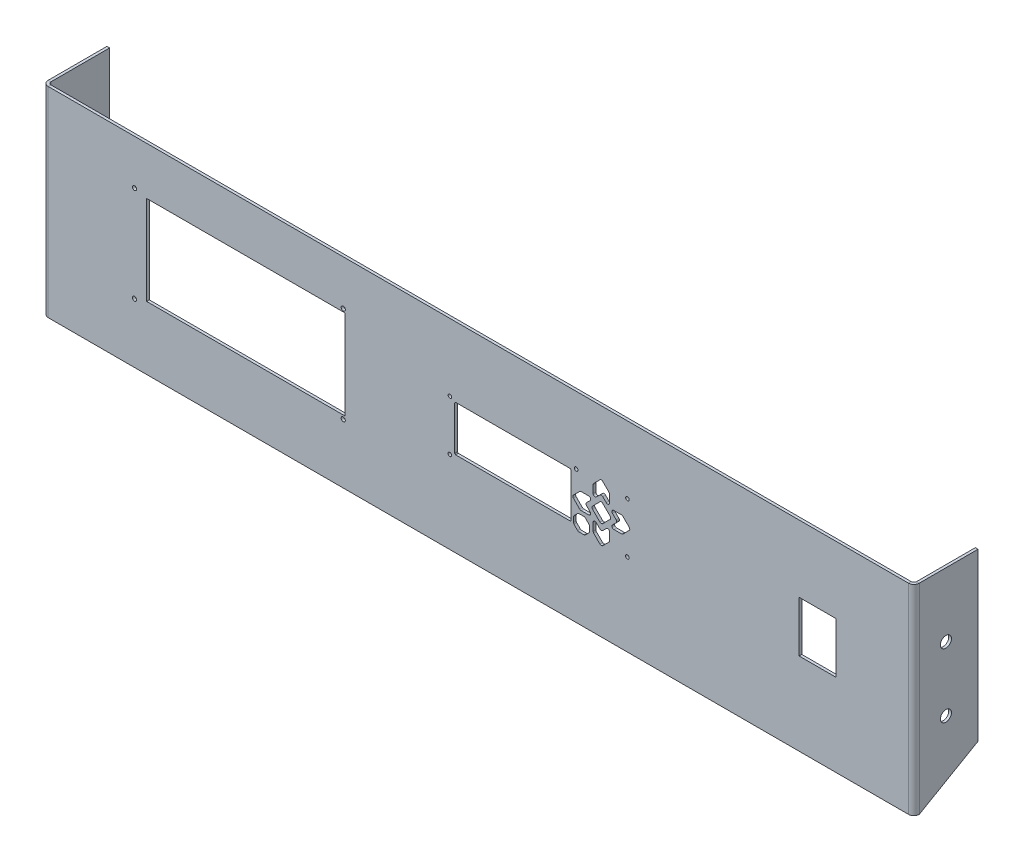
from build123d import *

# Parameters (mm, degrees)
SKETCH1_W                      = 514.4008
SKETCH1_H                      = 119
BOSS_EXTRUDE1_DEPTH            = 1.6002
EDGE_FLANGE1_STRIP_W           = 9.6012
EDGE_FLANGE1_STRIP_H           = 1.6002
EDGE_FLANGE1_STRIP_CUT_DEPTH   = 119
EDGE_FLANGE1_STRIP_2_W         = 9.6012
EDGE_FLANGE1_STRIP_2_H         = 1.6002
EDGE_FLANGE1_STRIP_CUT_2_DEPTH = 119
EDGE_FLANGE1_DEPTH             = 119
EDGE_FLANGE1_BEND_DEPTH        = 119
SKETCH19_R                     = 3.2639
CUT_EXTRUDE1_DEPTH             = 523.286786777
SKETCH21_R                     = 1.25
SKETCH21_W                     = 117.999999966
SKETCH21_H                     = 53
CUT_EXTRUDE3_DEPTH             = 2.54
SKETCH22_W                     = 21.9964
SKETCH22_H                     = 30.2006
CUT_EXTRUDE4_DEPTH             = 2.54
SKETCH23_R                     = 1.079501479
SKETCH23_W                     = 69.208094806
SKETCH23_H                     = 27.008036997
CUT_EXTRUDE5_DEPTH             = 2.54
CHAMFER1_SIZE                  = 0.5
CUT_EXTRUDE6_DEPTH             = 523.286786777


# Sheet-metal steps are written as plain solids
with BuildPart() as part:
    # Sketch1 → Boss-Extrude1 (new body)
    with BuildSketch(Plane.XY):
        Rectangle(SKETCH1_W, SKETCH1_H)
    extrude(amount=BOSS_EXTRUDE1_DEPTH)

    # Edge-Flange1 strip (across the edge) → Edge-Flange1 strip cut (cut)
    with BuildSketch(Plane(origin=(257.2004, 59.5, 0), x_dir=(-1, 0, 0), z_dir=(0, -1, 0))):
        with Locations((-3.2004, -0.8001)):
            Rectangle(EDGE_FLANGE1_STRIP_W, EDGE_FLANGE1_STRIP_H)
    extrude(amount=EDGE_FLANGE1_STRIP_CUT_DEPTH, mode=Mode.SUBTRACT)

    # Edge-Flange1 strip 2 (across the edge) → Edge-Flange1 strip cut 2 (cut)
    with BuildSketch(Plane(origin=(-257.2004, -59.5, 0), x_dir=(1, 0, 0), z_dir=(0, 1, 0))):
        with Locations((-3.2004, -0.8001)):
            Rectangle(EDGE_FLANGE1_STRIP_2_W, EDGE_FLANGE1_STRIP_2_H)
    extrude(amount=EDGE_FLANGE1_STRIP_CUT_2_DEPTH, mode=Mode.SUBTRACT)

    # Edge-Flange1 section (across the edge) → Edge-Flange1 (add)
    with BuildSketch(Plane(origin=(257.2004, 59.5, 0), x_dir=(-1, 0, 0), z_dir=(0, -1, 0))):
        with BuildLine():
            Line((-1.6002, 1.6002), (-1.6002, 36.4998))
            Line((-1.6002, 36.4998), (0, 36.4998))
            Line((0, 36.4998), (0, 1.6002))
            ThreePointArc((0, 1.6002), (0.468687729, 0.468687729), (1.6002, 0))
            Line((1.6002, 0), (1.6002, -1.6002))
            ThreePointArc((1.6002, -1.6002), (-0.662824543, -0.662824543), (-1.6002, 1.6002))
        make_face()
    extrude(amount=EDGE_FLANGE1_DEPTH)

    # Edge-Flange1 section 2 (across the edge) → Edge-Flange1 bend (add)
    with BuildSketch(Plane(origin=(-257.2004, -59.5, 0), x_dir=(1, 0, 0), z_dir=(0, 1, 0))):
        with BuildLine():
            Line((-1.6002, 1.6002), (-1.6002, 36.4998))
            Line((-1.6002, 36.4998), (0, 36.4998))
            Line((0, 36.4998), (0, 1.6002))
            ThreePointArc((0, 1.6002), (0.468687729, 0.468687729), (1.6002, 0))
            Line((1.6002, 0), (1.6002, -1.6002))
            ThreePointArc((1.6002, -1.6002), (-0.662824543, -0.662824543), (-1.6002, 1.6002))
        make_face()
    extrude(amount=EDGE_FLANGE1_BEND_DEPTH)

    # Sketch19 → Cut-Extrude1 (cut, through all)
    with BuildSketch(Plane(origin=(258.8006, 0, 0), x_dir=(0, 0, -1), z_dir=(1, 0, 0))):
        with Locations((17.4498, 21.4)):
            Circle(SKETCH19_R)
        with Locations((17.4498, -16.7)):
            Circle(SKETCH19_R)
    extrude(amount=-CUT_EXTRUDE1_DEPTH, mode=Mode.SUBTRACT)

    # Sketch21 → Cut-Extrude3 (cut)
    with BuildSketch(Plane.XY.offset(1.6002)):
        with Locations((-204.299799983, 32.869379504)):
            Circle(SKETCH21_R)
        with Locations((-80.299799983, 32.869379504)):
            Circle(SKETCH21_R)
        with Locations((-204.299799983, -24.130620496)):
            Circle(SKETCH21_R)
        with Locations((-80.299799983, -24.130620496)):
            Circle(SKETCH21_R)
        with Locations((-138.0998, 4.619379504)):
            Rectangle(SKETCH21_W, SKETCH21_H)
    extrude(amount=-CUT_EXTRUDE3_DEPTH, mode=Mode.SUBTRACT)

    # Sketch22 → Cut-Extrude4 (cut)
    with BuildSketch(Plane.XY.offset(1.6002)):
        with Locations((201.5998, 4.619379504)):
            Rectangle(SKETCH22_W, SKETCH22_H)
    extrude(amount=-CUT_EXTRUDE4_DEPTH, mode=Mode.SUBTRACT)

    # Sketch23 → Cut-Extrude5 (cut)
    with BuildSketch(Plane.XY.offset(1.6002)):
        with Locations((-16.92801633, 19.475664516)):
            Circle(SKETCH23_R)
        with Locations((-16.92801633, -10.52437658)):
            Circle(SKETCH23_R)
        with Locations((58.07208641, 19.475664516)):
            Circle(SKETCH23_R)
        with Locations((88.572128191, 19.475664516)):
            Circle(SKETCH23_R)
        with Locations((88.572128191, -10.52437658)):
            Circle(SKETCH23_R)
        with Locations((20.57203504, 4.475643969)):
            Rectangle(SKETCH23_W, SKETCH23_H)
        with BuildLine():
            Line((81.870702539, 5.275383569), (79.720177643, 7.425908465))
            ThreePointArc((79.720177643, 7.425908465), (79.4750071, 8.658464018), (80.519917243, 9.356650655))
            Line((80.519917243, 9.356650655), (85.103371505, 9.356650655))
            ThreePointArc((85.103371505, 9.356650655), (85.537484246, 9.270020118), (85.905094187, 9.023399655))
            Line((85.905094187, 9.023399655), (89.636523764, 5.273395558))
            ThreePointArc((89.636523764, 5.273395558), (89.965803671, 4.475643968), (89.636523764, 3.677892379))
            Line((89.636523764, 3.677892379), (85.905094187, -0.072111718))
            ThreePointArc((85.905094187, -0.072111718), (85.537484246, -0.318732182), (85.103371505, -0.405362718))
            Line((85.103371505, -0.405362718), (80.519917243, -0.405362718))
            ThreePointArc((80.519917243, -0.405362718), (79.4750071, 0.292823919), (79.720177643, 1.525379472))
            Line((79.720177643, 1.525379472), (81.870702539, 3.675904368))
            ThreePointArc((81.870702539, 3.675904368), (82.201965528, 4.475643968), (81.870702539, 5.275383569))
        make_face()
        with BuildLine():
            Line((73.871846558, 9.714604607), (78.311067597, 5.275383569))
            ThreePointArc((78.311067597, 5.275383569), (78.642330586, 4.475643968), (78.311067597, 3.675904368))
            Line((78.311067597, 3.675904368), (73.871846558, -0.763316671))
            ThreePointArc((73.871846558, -0.763316671), (73.072106958, -1.094579659), (72.272367358, -0.763316671))
            Line((72.272367358, -0.763316671), (67.833146319, 3.675904368))
            ThreePointArc((67.833146319, 3.675904368), (67.50188333, 4.475643968), (67.833146319, 5.275383569))
            Line((67.833146319, 5.275383569), (72.272367358, 9.714604607))
            ThreePointArc((72.272367358, 9.714604607), (73.072106958, 10.045867596), (73.871846558, 9.714604607))
        make_face()
        with BuildLine():
            Line((72.272367358, 13.274239549), (70.121842461, 11.123714653))
            ThreePointArc((70.121842461, 11.123714653), (68.889286908, 10.87854411), (68.191100272, 11.923454253))
            Line((68.191100272, 11.923454253), (68.191100272, 16.506908516))
            ThreePointArc((68.191100272, 16.506908516), (68.277730808, 16.941021257), (68.524351272, 17.308631198))
            Line((68.524351272, 17.308631198), (72.274355369, 21.040060774))
            ThreePointArc((72.274355369, 21.040060774), (73.072106958, 21.369340682), (73.869858547, 21.040060774))
            Line((73.869858547, 21.040060774), (77.619862644, 17.308631198))
            ThreePointArc((77.619862644, 17.308631198), (77.866483108, 16.941021257), (77.953113644, 16.506908516))
            Line((77.953113644, 16.506908516), (77.953113644, 11.923454254))
            ThreePointArc((77.953113644, 11.923454254), (77.254927008, 10.87854411), (76.022371455, 11.123714653))
            Line((76.022371455, 11.123714653), (73.871846558, 13.274239549))
            ThreePointArc((73.871846558, 13.274239549), (73.072106958, 13.605502538), (72.272367358, 13.274239549))
        make_face()
        with BuildLine():
            Line((64.273511377, 3.675904368), (66.424036273, 1.525379472))
            ThreePointArc((66.424036273, 1.525379472), (66.669206816, 0.292823919), (65.624296673, -0.405362718))
            Line((65.624296673, -0.405362718), (61.040842411, -0.405362718))
            ThreePointArc((61.040842411, -0.405362718), (60.60672967, -0.318732182), (60.239119729, -0.072111718))
            Line((60.239119729, -0.072111718), (56.507690152, 3.677892379))
            ThreePointArc((56.507690152, 3.677892379), (56.178410245, 4.475643968), (56.507690152, 5.273395558))
            Line((56.507690152, 5.273395558), (60.239119729, 9.023399655))
            ThreePointArc((60.239119729, 9.023399655), (60.60672967, 9.270020118), (61.040842411, 9.356650655))
            Line((61.040842411, 9.356650655), (65.624296673, 9.356650655))
            ThreePointArc((65.624296673, 9.356650655), (66.669206816, 8.658464018), (66.424036273, 7.425908465))
            Line((66.424036273, 7.425908465), (64.273511377, 5.275383569))
            ThreePointArc((64.273511377, 5.275383569), (63.942248388, 4.475643968), (64.273511377, 3.675904368))
        make_face()
        with BuildLine():
            Line((73.871846558, -4.322951612), (76.022371455, -2.172426716))
            ThreePointArc((76.022371455, -2.172426716), (77.254927008, -1.927256173), (77.953113644, -2.972166317))
            Line((77.953113644, -2.972166317), (77.953113644, -7.555620579))
            ThreePointArc((77.953113644, -7.555620579), (77.866483108, -7.98973332), (77.619862644, -8.357343261))
            Line((77.619862644, -8.357343261), (73.869858547, -12.088772838))
            ThreePointArc((73.869858547, -12.088772838), (73.072106958, -12.418052745), (72.274355369, -12.088772838))
            Line((72.274355369, -12.088772838), (68.524351272, -8.357343261))
            ThreePointArc((68.524351272, -8.357343261), (68.277730808, -7.98973332), (68.191100272, -7.555620579))
            Line((68.191100272, -7.555620579), (68.191100272, -2.972166317))
            ThreePointArc((68.191100272, -2.972166317), (68.889286908, -1.927256173), (70.121842461, -2.172426716))
            Line((70.121842461, -2.172426716), (72.272367358, -4.322951612))
            ThreePointArc((72.272367358, -4.322951612), (73.072106958, -4.654214601), (73.871846558, -4.322951612))
        make_face()
        with BuildLine():
            Line((65.627833205, -5.059889025), (63.536573965, -2.968629784))
            ThreePointArc((63.536573965, -2.968629784), (63.169650317, -2.723459241), (62.736834364, -2.637366795))
            Line((62.736834364, -2.637366795), (59.779347184, -2.637366795))
            ThreePointArc((59.779347184, -2.637366795), (59.346531231, -2.723459241), (58.979607584, -2.968629784))
            Line((58.979607584, -2.968629784), (56.888348343, -5.059889025))
            ThreePointArc((56.888348343, -5.059889025), (56.6431778, -5.426812672), (56.557085355, -5.859628625))
            Line((56.557085355, -5.859628625), (56.557085355, -8.817115805))
            ThreePointArc((56.557085355, -8.817115805), (56.6431778, -9.249931758), (56.888348343, -9.616855406))
            Line((56.888348343, -9.616855406), (58.979607584, -11.708114646))
            ThreePointArc((58.979607584, -11.708114646), (59.346531231, -11.953285189), (59.779347184, -12.039377635))
            Line((59.779347184, -12.039377635), (62.736834364, -12.039377635))
            ThreePointArc((62.736834364, -12.039377635), (63.169650317, -11.953285189), (63.536573965, -11.708114646))
            Line((63.536573965, -11.708114646), (65.627833205, -9.616855406))
            ThreePointArc((65.627833205, -9.616855406), (65.873003748, -9.249931758), (65.959096194, -8.817115805))
            Line((65.959096194, -8.817115805), (65.959096194, -5.859628625))
            ThreePointArc((65.959096194, -5.859628625), (65.873003748, -5.426812672), (65.627833205, -5.059889025))
        make_face()
    extrude(amount=-CUT_EXTRUDE5_DEPTH, mode=Mode.SUBTRACT)

    # Chamfer1
    chamfer1_edges = [part.edges().sort_by_distance(p)[0] for p in [
        (-14.032012363, -9.02837453, 0.8001),
        (-14.032012363, 17.979662467, 0.8001),
        (55.176082443, 17.979662467, 0.8001),
        (55.176082443, -9.02837453, 0.8001),
    ]]
    chamfer(chamfer1_edges, length=CHAMFER1_SIZE)

    # Sketch24 → Cut-Extrude6 (cut, through all)
    with BuildSketch(Plane(origin=(258.8006, 0, 0), x_dir=(0, 0, -1), z_dir=(1, 0, 0))):
        Polygon((1.6002, -59.5), (36.4998, -39.350706545), (36.4998, -59.5), align=None)
    extrude(amount=-CUT_EXTRUDE6_DEPTH, mode=Mode.SUBTRACT)


solid = part.part
